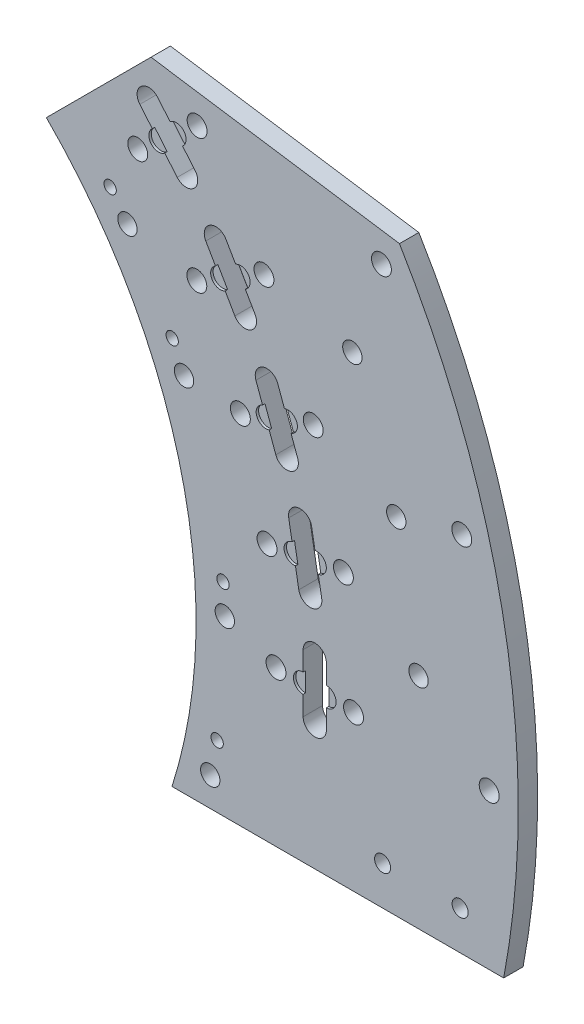
from build123d import *

# Parameters (mm, degrees)
SKETCH1_R           = 3.175
SKETCH1_R_2         = 2.0193
SKETCH1_R_3         = 3.2639
SKETCH1_R_4         = 2.6289
BOSS_EXTRUDE1_DEPTH = 6.35
SKETCH2_R           = 3.175
CUT_EXTRUDE1_DEPTH  = 0.79375


with BuildPart() as part:
    # Sketch1 → Boss-Extrude1 (new body)
    with BuildSketch(Plane.XY):
        with BuildLine():
            ThreePointArc((167.48125, 0), (165.496965553, -25.70454229), (159.591131024, -50.8))
            Line((159.591131024, -50.8), (268.282803213, -50.8))
            ThreePointArc((268.282803213, -50.8), (268.798556268, 47.996235774), (234.123018172, 140.508771477))
            Line((234.123018172, 140.508771477), (152.715190262, 152.715190262))
            Line((152.715190262, 152.715190262), (118.427127597, 118.427127597))
            ThreePointArc((118.427127597, 118.427127597), (154.732498954, 64.092299607), (167.48125, 0))
        make_face()
        with Locations((172.12665951, -41.275)):
            Circle(SKETCH1_R, mode=Mode.SUBTRACT)
        with Locations((174.391744453, -30.310592304)):
            Circle(SKETCH1_R_2, mode=Mode.SUBTRACT)
        with Locations((193.675, 0)):
            Circle(SKETCH1_R_3, mode=Mode.SUBTRACT)
        with Locations((176.310003304, 15.684236481)):
            Circle(SKETCH1_R_2, mode=Mode.SUBTRACT)
        with Locations((176.898422575, 6.177429038)):
            Circle(SKETCH1_R, mode=Mode.SUBTRACT)
        with Locations((190.732641565, 33.63131081)):
            Circle(SKETCH1_R_3, mode=Mode.SUBTRACT)
        with Locations((228.6, -38.1)):
            Circle(SKETCH1_R_4, mode=Mode.SUBTRACT)
        with BuildLine():
            Line((202.565, -9.525), (202.565, 0))
            Line((202.565, 0), (202.565, 9.525))
            ThreePointArc((202.565, 9.525), (206.375, 13.335), (210.185, 9.525))
            Line((210.185, 9.525), (210.185, 0))
            Line((210.185, 0), (210.185, -9.525))
            ThreePointArc((210.185, -9.525), (206.375, -13.335), (202.565, -9.525))
        make_face(mode=Mode.SUBTRACT)
        with Locations((219.075, 0)):
            Circle(SKETCH1_R_3, mode=Mode.SUBTRACT)
        with Locations((254, -38.1)):
            Circle(SKETCH1_R_4, mode=Mode.SUBTRACT)
        with Locations((263.525, 0)):
            Circle(SKETCH1_R_3, mode=Mode.SUBTRACT)
        with BuildLine():
            Line((201.141581381, 25.794749262), (199.487582489, 35.175043109))
            Line((199.487582489, 35.175043109), (197.833583597, 44.555336957))
            ThreePointArc((197.833583597, 44.555336957), (200.924101579, 48.969054052), (205.337818675, 45.87853607))
            Line((205.337818675, 45.87853607), (206.991817567, 36.498242223))
            Line((206.991817567, 36.498242223), (208.645816459, 27.117948375))
            ThreePointArc((208.645816459, 27.117948375), (205.555298477, 22.70423128), (201.141581381, 25.794749262))
        make_face(mode=Mode.SUBTRACT)
        with Locations((215.746758491, 38.041974522)):
            Circle(SKETCH1_R_3, mode=Mode.SUBTRACT)
        with Locations((240.38178065, 21.030680725)):
            Circle(SKETCH1_R, mode=Mode.SUBTRACT)
        with Locations((144.995031539, 101.526614087)):
            Circle(SKETCH1_R, mode=Mode.SUBTRACT)
        with Locations((163.532451502, 67.7373593)):
            Circle(SKETCH1_R, mode=Mode.SUBTRACT)
        with Locations((181.994968331, 66.240751259)):
            Circle(SKETCH1_R_3, mode=Mode.SUBTRACT)
        with BuildLine():
            Line((193.606577595, 60.33073812), (190.348835729, 69.281310333))
            Line((190.348835729, 69.281310333), (187.091093864, 78.231882546))
            ThreePointArc((187.091093864, 78.231882546), (189.368226003, 83.115208177), (194.251551635, 80.838076038))
            Line((194.251551635, 80.838076038), (197.5092935, 71.887503825))
            Line((197.5092935, 71.887503825), (200.767035365, 62.936931612))
            ThreePointArc((200.767035365, 62.936931612), (198.489903226, 58.053605981), (193.606577595, 60.33073812))
        make_face(mode=Mode.SUBTRACT)
        with Locations((159.651941396, 76.436052669)):
            Circle(SKETCH1_R_2, mode=Mode.SUBTRACT)
        with Locations((167.727470078, 96.8375)):
            Circle(SKETCH1_R_3, mode=Mode.SUBTRACT)
        with Locations((139.323763183, 109.179217581)):
            Circle(SKETCH1_R_2, mode=Mode.SUBTRACT)
        with Locations((148.363657521, 124.491890306)):
            Circle(SKETCH1_R_3, mode=Mode.SUBTRACT)
        with BuildLine():
            Line((180.188935918, 93.033608029), (175.426435918, 101.2825))
            Line((175.426435918, 101.2825), (170.663935918, 109.531391971))
            ThreePointArc((170.663935918, 109.531391971), (172.058492706, 114.735948759), (177.263049494, 113.341391971))
            Line((177.263049494, 113.341391971), (182.025549494, 105.0925))
            Line((182.025549494, 105.0925), (186.788049494, 96.843608029))
            ThreePointArc((186.788049494, 96.843608029), (185.393492706, 91.639051241), (180.188935918, 93.033608029))
        make_face(mode=Mode.SUBTRACT)
        with Locations((189.724515334, 109.5375)):
            Circle(SKETCH1_R_3, mode=Mode.SUBTRACT)
        with BuildLine():
            Line((161.296344603, 122.909698835), (155.17379262, 130.206272156))
            Line((155.17379262, 130.206272156), (149.051240638, 137.502845477))
            ThreePointArc((149.051240638, 137.502845477), (149.520849174, 142.870495598), (154.888499295, 142.400887063))
            Line((154.888499295, 142.400887063), (161.011051277, 135.104313742))
            Line((161.011051277, 135.104313742), (167.133603259, 127.807740421))
            ThreePointArc((167.133603259, 127.807740421), (166.663994724, 122.4400903), (161.296344603, 122.909698835))
        make_face(mode=Mode.SUBTRACT)
        with Locations((167.821186376, 140.818695592)):
            Circle(SKETCH1_R_3, mode=Mode.SUBTRACT)
        with Locations((205.863160899, 74.928062899)):
            Circle(SKETCH1_R_3, mode=Mode.SUBTRACT)
        with Locations((233.077901884, 62.453035583)):
            Circle(SKETCH1_R, mode=Mode.SUBTRACT)
        with Locations((254.545603373, 68.205288861)):
            Circle(SKETCH1_R_3, mode=Mode.SUBTRACT)
        with Locations((218.692069012, 101.977786558)):
            Circle(SKETCH1_R, mode=Mode.SUBTRACT)
        with Locations((228.219344532, 131.7625)):
            Circle(SKETCH1_R_3, mode=Mode.SUBTRACT)
    extrude(amount=BOSS_EXTRUDE1_DEPTH)

    # Sketch2 → Cut-Extrude1 (cut)
    with BuildSketch(Plane.XY.offset(6.35)):
        with Locations((202.565, 0)):
            Circle(SKETCH2_R)
        with Locations((210.185, 0)):
            Circle(SKETCH2_R)
        with Locations((199.487582489, 35.175043109)):
            Circle(SKETCH2_R)
        with Locations((206.991817567, 36.498242223)):
            Circle(SKETCH2_R)
        with Locations((190.348835729, 69.281310333)):
            Circle(SKETCH2_R)
        with Locations((197.5092935, 71.887503825)):
            Circle(SKETCH2_R)
        with Locations((175.426435918, 101.2825)):
            Circle(SKETCH2_R)
        with Locations((182.025549494, 105.0925)):
            Circle(SKETCH2_R)
        with Locations((155.17379262, 130.206272156)):
            Circle(SKETCH2_R)
        with Locations((161.011051277, 135.104313742)):
            Circle(SKETCH2_R)
    extrude(amount=-CUT_EXTRUDE1_DEPTH, mode=Mode.SUBTRACT)


solid = part.part
